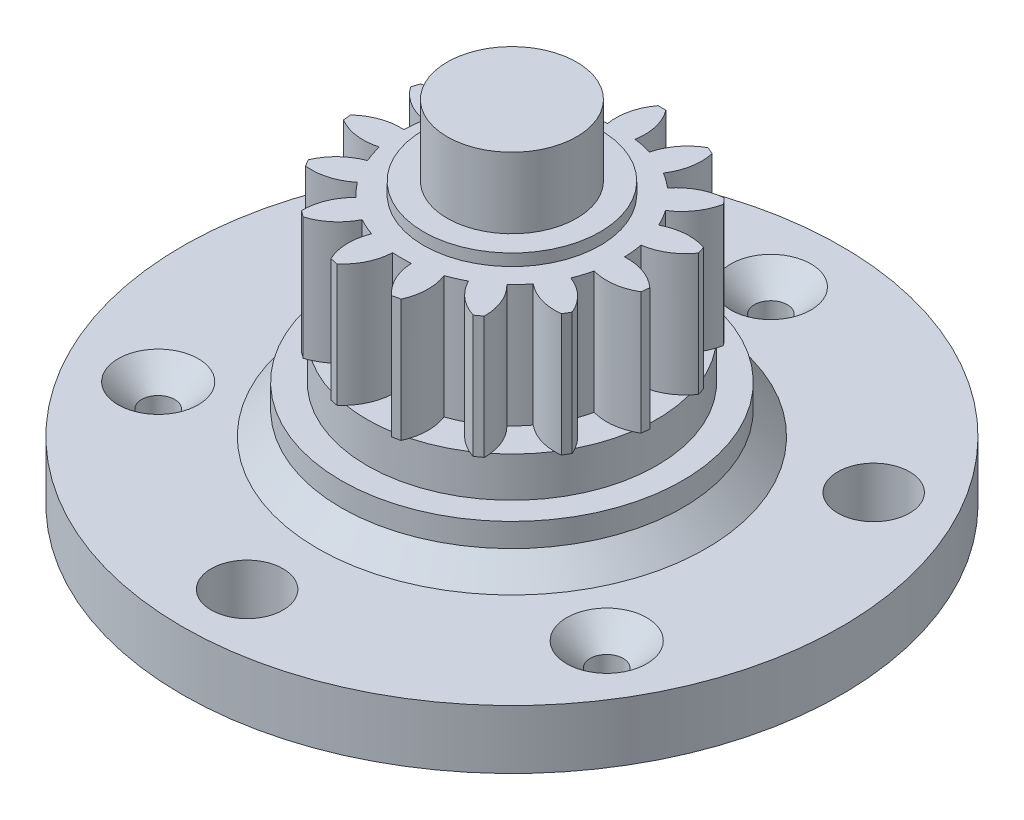
from build123d import *

# Parameters (mm, degrees)
ESBO_O1_R                = 28
RESSALTO_EXTRUS_O1_DEPTH = 5
ESBO_O6_R                = 10.75
CORTE_EXTRUS_O1_DEPTH    = 5
ESBO_O7_R                = 9
CORTE_EXTRUS_O2_DEPTH    = 0.4
CORTE_EXTRUS_O3_REACH    = 51.558
ESBO_O8_R                = 3.05
PADR_OCIRCULAR1_COUNT    = 3
CORTE_EXTRUS_O4_REACH    = 51.558
ESBO_O9_R                = 1.4
PADR_OCIRCULAR2_COUNT    = 3
PADR_OCIRCULAR3_COUNT    = 3
CHANFRO1_SIZE            = 2
CHANFRO2_SIZE            = 2
RESSALTO_EXTRUS_O2_DEPTH = 10.4
PADR_OCIRCULAR4_COUNT    = 15


with BuildPart() as part:
    # Esboço1 → Ressalto-extrusão1 (new body)
    with BuildSketch(Plane(origin=(0, 0, 0), x_dir=(1, 0, 0), z_dir=(0, 1, 0))):
        with Locations(Location((0, 0, 0), (0, 0, 270))):
            Circle(ESBO_O1_R)
    extrude(amount=RESSALTO_EXTRUS_O1_DEPTH)

    # Esboço5 → Revolução1 (revolve)
    with BuildSketch(Plane(origin=(0, 0, 0), x_dir=(0, 0, -1), z_dir=(1, 0, 0))):
        Polygon((0, 5), (-16.5, 5), (-14.5, 7), (-14.5, 9), (-12.3, 9), (-12.3, 12.4), (-9.37, 12.4), (-9.37, 22.8), (-7.5, 22.8), (-7.5, 23.8), (-5.5, 23.8), (-5.5, 29.8), (0, 29.8), align=None)
    revolve(axis=Axis((0, 29.8, 0), (0, -1, 0)))

    # Esboço6 → Corte-extrusão1 (cut)
    with BuildSketch(Plane.XZ):
        with Locations(Location((0, 0, 0), (0, 0, 270))):
            Circle(ESBO_O6_R)
    extrude(amount=-CORTE_EXTRUS_O1_DEPTH, mode=Mode.SUBTRACT)

    # Esboço7 → Corte-extrusão2 (cut)
    with BuildSketch(Plane.XZ.offset(-5)):
        with Locations(Location((0, 0, 0), (0, 0, 270))):
            Circle(ESBO_O7_R)
    extrude(amount=-CORTE_EXTRUS_O2_DEPTH, mode=Mode.SUBTRACT)

    # Esboço8 → Corte-extrusão3 (cut, up to next)
    with BuildSketch(Plane.XZ, mode=Mode.PRIVATE) as corte_extrus_o3_sk1:
        with Locations(Location((0, 22.5, 0), (0, 0, 270))):
            Circle(ESBO_O8_R)
    corte_extrus_o3_tool1 = extrude(corte_extrus_o3_sk1.sketch, amount=-CORTE_EXTRUS_O3_REACH, mode=Mode.PRIVATE) & part.part
    corte_extrus_o3 = corte_extrus_o3_tool1.solids().sort_by_distance((0, 0, 22.5))[0]
    add(corte_extrus_o3, mode=Mode.SUBTRACT)

    # PadrãoCircular1: Corte-extrusão3 ×3 about axis
    padr_ocircular1_axis = Axis((0, 0, 0), (0, 1, 0))
    for i in range(1, PADR_OCIRCULAR1_COUNT):
        add(corte_extrus_o3.rotate(padr_ocircular1_axis, i * 360 / PADR_OCIRCULAR1_COUNT), mode=Mode.SUBTRACT)

    # Esboço9 → Corte-extrusão4 (cut, up to next)
    with BuildSketch(Plane.XZ, mode=Mode.PRIVATE) as corte_extrus_o4_sk1:
        with Locations(Location((-19.052558883, 11, 0), (0, 0, 270))):
            Circle(ESBO_O9_R)
    corte_extrus_o4_tool1 = extrude(corte_extrus_o4_sk1.sketch, amount=-CORTE_EXTRUS_O4_REACH, mode=Mode.PRIVATE) & part.part
    corte_extrus_o4 = corte_extrus_o4_tool1.solids().sort_by_distance((-19.052559, 0, 11))[0]
    add(corte_extrus_o4, mode=Mode.SUBTRACT)

    # PadrãoCircular2: Corte-extrusão4 ×3 about axis
    padr_ocircular2_axis = Axis((0, 0, 0), (0, 1, 0))
    for i in range(1, PADR_OCIRCULAR2_COUNT):
        add(corte_extrus_o4.rotate(padr_ocircular2_axis, i * 360 / PADR_OCIRCULAR2_COUNT), mode=Mode.SUBTRACT)

    # Loft de corte1: read off the stored shape, not the designer's step
    # Loft de corte1: loft between two sections, ruled curve by curve
    loft_de_corte1_from = [
        Edge.make_bspline([(-18.260331243, 3, 17.20543513), (-17.315862444, 3, 16.040111704), (-16.150539018, 3, 16.984580503), (-17.095007817, 3, 18.149903929), (-18.039476615, 3, 19.315227355), (-19.204800042, 3, 18.370758556), (-18.260331243, 3, 17.20543513)], [0, 0, 0, 0, 0.5, 0.5, 0.5, 1, 1, 1, 1], 3, [1, 0.333333333, 0.333333333, 1, 0.333333333, 0.333333333, 1]),
    ]
    loft_de_corte1_to = [
        Edge.make_bspline([(-18.914864913, 0, 17.499210616), (-18.557947085, 0, 15.024819849), (-16.083556319, 0, 15.381737677), (-16.440474147, 0, 17.856128444), (-16.797391974, 0, 20.33051921), (-19.271782741, 0, 19.973601382), (-18.914864913, 0, 17.499210616)], [0, 0, 0, 0, 0.5, 0.5, 0.5, 1, 1, 1, 1], 3, [1, 0.333333333, 0.333333333, 1, 0.333333333, 0.333333333, 1]),
    ]
    loft_de_corte1 = Solid(Shell([*[Face.make_surface_from_curves(loft_de_corte1_from[k], loft_de_corte1_to[k]) for k in range(1)], Face(Wire(loft_de_corte1_from)), Face(Wire(loft_de_corte1_to))]))
    add(loft_de_corte1, mode=Mode.SUBTRACT)

    # PadrãoCircular3: Loft de corte1 ×3 about axis
    padr_ocircular3_axis = Axis((0, 0, 0), (0, 1, 0))
    for i in range(1, PADR_OCIRCULAR3_COUNT):
        add(loft_de_corte1.rotate(padr_ocircular3_axis, i * 360 / PADR_OCIRCULAR3_COUNT), mode=Mode.SUBTRACT)

    # Chanfro1
    chanfro1_edges = [part.edges().sort_by_distance(p)[0] for p in [
        (-19.052558883, 5, 12.4),
    ]]
    chamfer(chanfro1_edges, length=CHANFRO1_SIZE)

    # Chanfro2
    chanfro2_edges = [part.edges().sort_by_distance(p)[0] for p in [
        (20.264994449, 5, 10.3),
        (-1.212435565, 5, -22.7),
    ]]
    chamfer(chanfro2_edges, length=CHANFRO2_SIZE)

    # Esboço15 → Ressalto-extrusão2 (add)
    with BuildSketch(Plane(origin=(0, 22.8, 0), x_dir=(1, 0, 0), z_dir=(0, 1, 0))):
        with BuildLine():
            Line((0.335, 12.75), (-0.335, 12.75))
            ThreePointArc((-0.335, 12.75), (-1.106422887, 11.109098221), (-1.167760303, 9.296947664))
            ThreePointArc((-1.167760303, 9.296947664), (0, 9.37), (1.167760303, 9.296947664))
            ThreePointArc((1.167760303, 9.296947664), (1.106422887, 11.109098221), (0.335, 12.75))
        make_face()
    ressalto_extrus_o2 = extrude(amount=-RESSALTO_EXTRUS_O2_DEPTH)

    # PadrãoCircular4: Ressalto-extrusão2 ×15 about axis
    padr_ocircular4_axis = Axis((0, 0, 0), (0, 1, 0))
    for i in range(1, PADR_OCIRCULAR4_COUNT):
        add(ressalto_extrus_o2.rotate(padr_ocircular4_axis, i * 360 / PADR_OCIRCULAR4_COUNT))


solid = part.part
